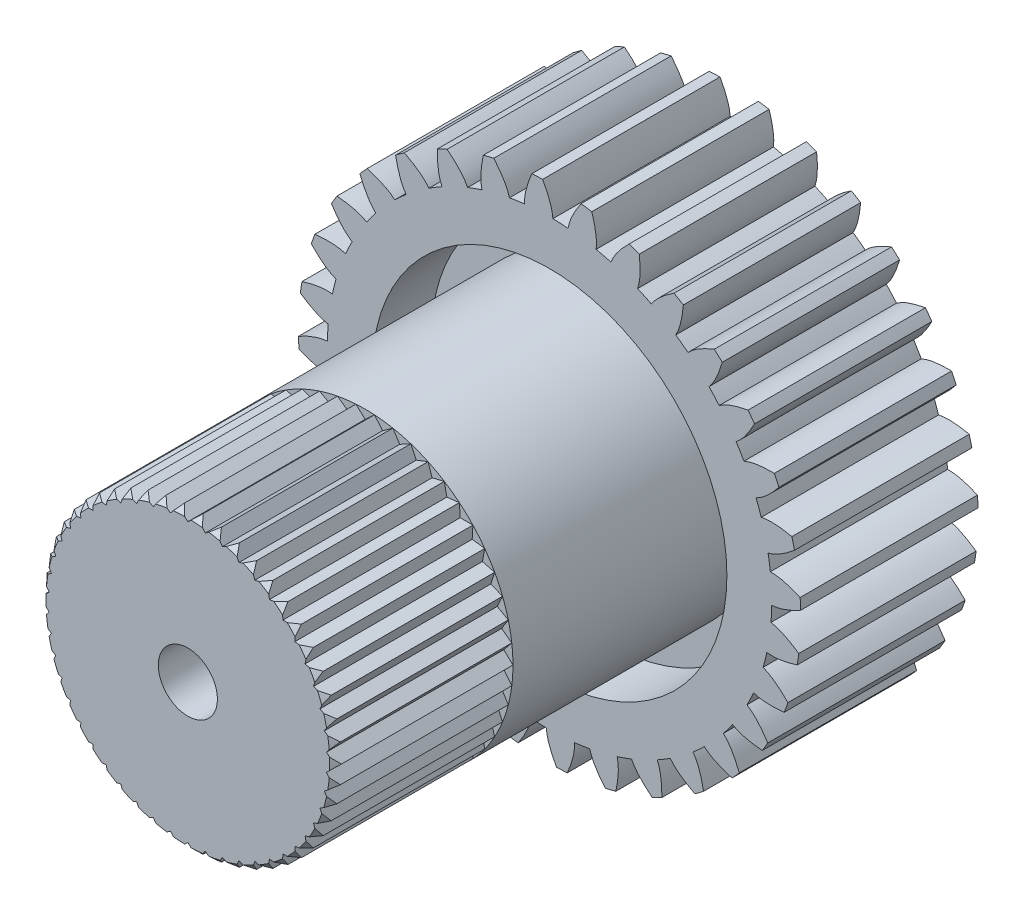
from build123d import *

# Parameters (mm, degrees)
BOSS_EXTRUDE7_DEPTH  = 3
CIRPATTERN1_COUNT    = 32
DIAMETRO_BASE_R      = 3.758770483
BOSS_EXTRUDE9_DEPTH  = 3
MOZZO_R              = 0.5
CUT_EXTRUDE1_DEPTH   = 3
SKETCH1_R            = 3
CUT_EXTRUDE2_DEPTH   = 1
SKETCH2_R            = 2.5
SKETCH2_R_2          = 0.5
BOSS_EXTRUDE10_DEPTH = 7.12
CHAMFER1_SIZE        = 0.1
CUT_EXTRUDE3_START   = -3
CUT_EXTRUDE3_DEPTH   = 3
CIRPATTERN2_COUNT    = 50


with BuildPart() as part:
    # profilo → Boss-Extrude7 (new body)
    with BuildSketch(Plane.XY):
        with BuildLine():
            Line((-0.208537616, 4.244880689), (-0.184434126, 3.754242879))
            ThreePointArc((-0.184434126, 3.754242879), (-0.064239901, 3.758221492), (0.056020084, 3.758353003))
            add(Edge.make_bspline(
                [(-0.116842984, 4.248393545), (-0.034075941, 4.096076065), (0.042378759, 3.933500457), (0.056020084, 3.758353003)],
                knots=[0.080011926, 0.080011926, 0.080011926, 0.080011926, 1, 1, 1, 1], degree=3))
            ThreePointArc((-0.116842984, 4.248393545), (-0.162699781, 4.246884597), (-0.208537616, 4.244880689))
        make_face()
    extrude(amount=BOSS_EXTRUDE7_DEPTH)

    # Mirror1: part across plane


with BuildPart() as part_1:
    add(part.part)
    add(part.part.mirror(Plane(origin=(0, 0, 0), x_dir=(0, 0, 1), z_dir=(0.9987954562051725, 0.0490676743274181, 0))))


with BuildPart() as cirpattern1_1:
    # CirPattern1: pattern copy
    add(part_1.part.rotate(Axis((0, 0, 3), (0, 0, 1)), 1 * 360 / CIRPATTERN1_COUNT))


with BuildPart() as cirpattern1_2:
    # CirPattern1: pattern copy
    add(part_1.part.rotate(Axis((0, 0, 3), (0, 0, 1)), 2 * 360 / CIRPATTERN1_COUNT))


with BuildPart() as cirpattern1_3:
    # CirPattern1: pattern copy
    add(part_1.part.rotate(Axis((0, 0, 3), (0, 0, 1)), 3 * 360 / CIRPATTERN1_COUNT))


with BuildPart() as cirpattern1_4:
    # CirPattern1: pattern copy
    add(part_1.part.rotate(Axis((0, 0, 3), (0, 0, 1)), 4 * 360 / CIRPATTERN1_COUNT))


with BuildPart() as cirpattern1_5:
    # CirPattern1: pattern copy
    add(part_1.part.rotate(Axis((0, 0, 3), (0, 0, 1)), 5 * 360 / CIRPATTERN1_COUNT))


with BuildPart() as cirpattern1_6:
    # CirPattern1: pattern copy
    add(part_1.part.rotate(Axis((0, 0, 3), (0, 0, 1)), 6 * 360 / CIRPATTERN1_COUNT))


with BuildPart() as cirpattern1_7:
    # CirPattern1: pattern copy
    add(part_1.part.rotate(Axis((0, 0, 3), (0, 0, 1)), 7 * 360 / CIRPATTERN1_COUNT))


with BuildPart() as cirpattern1_8:
    # CirPattern1: pattern copy
    add(part_1.part.rotate(Axis((0, 0, 3), (0, 0, 1)), 8 * 360 / CIRPATTERN1_COUNT))


with BuildPart() as cirpattern1_9:
    # CirPattern1: pattern copy
    add(part_1.part.rotate(Axis((0, 0, 3), (0, 0, 1)), 9 * 360 / CIRPATTERN1_COUNT))


with BuildPart() as cirpattern1_10:
    # CirPattern1: pattern copy
    add(part_1.part.rotate(Axis((0, 0, 3), (0, 0, 1)), 10 * 360 / CIRPATTERN1_COUNT))


with BuildPart() as cirpattern1_11:
    # CirPattern1: pattern copy
    add(part_1.part.rotate(Axis((0, 0, 3), (0, 0, 1)), 11 * 360 / CIRPATTERN1_COUNT))


with BuildPart() as cirpattern1_12:
    # CirPattern1: pattern copy
    add(part_1.part.rotate(Axis((0, 0, 3), (0, 0, 1)), 12 * 360 / CIRPATTERN1_COUNT))


with BuildPart() as cirpattern1_13:
    # CirPattern1: pattern copy
    add(part_1.part.rotate(Axis((0, 0, 3), (0, 0, 1)), 13 * 360 / CIRPATTERN1_COUNT))


with BuildPart() as cirpattern1_14:
    # CirPattern1: pattern copy
    add(part_1.part.rotate(Axis((0, 0, 3), (0, 0, 1)), 14 * 360 / CIRPATTERN1_COUNT))


with BuildPart() as cirpattern1_15:
    # CirPattern1: pattern copy
    add(part_1.part.rotate(Axis((0, 0, 3), (0, 0, 1)), 15 * 360 / CIRPATTERN1_COUNT))


with BuildPart() as cirpattern1_16:
    # CirPattern1: pattern copy
    add(part_1.part.rotate(Axis((0, 0, 3), (0, 0, 1)), 16 * 360 / CIRPATTERN1_COUNT))


with BuildPart() as cirpattern1_17:
    # CirPattern1: pattern copy
    add(part_1.part.rotate(Axis((0, 0, 3), (0, 0, 1)), 17 * 360 / CIRPATTERN1_COUNT))


with BuildPart() as cirpattern1_18:
    # CirPattern1: pattern copy
    add(part_1.part.rotate(Axis((0, 0, 3), (0, 0, 1)), 18 * 360 / CIRPATTERN1_COUNT))


with BuildPart() as cirpattern1_19:
    # CirPattern1: pattern copy
    add(part_1.part.rotate(Axis((0, 0, 3), (0, 0, 1)), 19 * 360 / CIRPATTERN1_COUNT))


with BuildPart() as cirpattern1_20:
    # CirPattern1: pattern copy
    add(part_1.part.rotate(Axis((0, 0, 3), (0, 0, 1)), 20 * 360 / CIRPATTERN1_COUNT))


with BuildPart() as cirpattern1_21:
    # CirPattern1: pattern copy
    add(part_1.part.rotate(Axis((0, 0, 3), (0, 0, 1)), 21 * 360 / CIRPATTERN1_COUNT))


with BuildPart() as cirpattern1_22:
    # CirPattern1: pattern copy
    add(part_1.part.rotate(Axis((0, 0, 3), (0, 0, 1)), 22 * 360 / CIRPATTERN1_COUNT))


with BuildPart() as cirpattern1_23:
    # CirPattern1: pattern copy
    add(part_1.part.rotate(Axis((0, 0, 3), (0, 0, 1)), 23 * 360 / CIRPATTERN1_COUNT))


with BuildPart() as cirpattern1_24:
    # CirPattern1: pattern copy
    add(part_1.part.rotate(Axis((0, 0, 3), (0, 0, 1)), 24 * 360 / CIRPATTERN1_COUNT))


with BuildPart() as cirpattern1_25:
    # CirPattern1: pattern copy
    add(part_1.part.rotate(Axis((0, 0, 3), (0, 0, 1)), 25 * 360 / CIRPATTERN1_COUNT))


with BuildPart() as cirpattern1_26:
    # CirPattern1: pattern copy
    add(part_1.part.rotate(Axis((0, 0, 3), (0, 0, 1)), 26 * 360 / CIRPATTERN1_COUNT))


with BuildPart() as cirpattern1_27:
    # CirPattern1: pattern copy
    add(part_1.part.rotate(Axis((0, 0, 3), (0, 0, 1)), 27 * 360 / CIRPATTERN1_COUNT))


with BuildPart() as cirpattern1_28:
    # CirPattern1: pattern copy
    add(part_1.part.rotate(Axis((0, 0, 3), (0, 0, 1)), 28 * 360 / CIRPATTERN1_COUNT))


with BuildPart() as cirpattern1_29:
    # CirPattern1: pattern copy
    add(part_1.part.rotate(Axis((0, 0, 3), (0, 0, 1)), 29 * 360 / CIRPATTERN1_COUNT))


with BuildPart() as cirpattern1_30:
    # CirPattern1: pattern copy
    add(part_1.part.rotate(Axis((0, 0, 3), (0, 0, 1)), 30 * 360 / CIRPATTERN1_COUNT))


with BuildPart() as cirpattern1_31:
    # CirPattern1: pattern copy
    add(part_1.part.rotate(Axis((0, 0, 3), (0, 0, 1)), 31 * 360 / CIRPATTERN1_COUNT))


with BuildPart() as part_2:
    add(part_1.part)

    add(cirpattern1_1.part)  # Boss-Extrude9 merges CirPattern1_1

    add(cirpattern1_2.part)  # Boss-Extrude9 merges CirPattern1_2

    add(cirpattern1_3.part)  # Boss-Extrude9 merges CirPattern1_3

    add(cirpattern1_4.part)  # Boss-Extrude9 merges CirPattern1_4

    add(cirpattern1_5.part)  # Boss-Extrude9 merges CirPattern1_5

    add(cirpattern1_6.part)  # Boss-Extrude9 merges CirPattern1_6

    add(cirpattern1_7.part)  # Boss-Extrude9 merges CirPattern1_7

    add(cirpattern1_8.part)  # Boss-Extrude9 merges CirPattern1_8

    add(cirpattern1_9.part)  # Boss-Extrude9 merges CirPattern1_9

    add(cirpattern1_10.part)  # Boss-Extrude9 merges CirPattern1_10

    add(cirpattern1_11.part)  # Boss-Extrude9 merges CirPattern1_11

    add(cirpattern1_12.part)  # Boss-Extrude9 merges CirPattern1_12

    add(cirpattern1_13.part)  # Boss-Extrude9 merges CirPattern1_13

    add(cirpattern1_14.part)  # Boss-Extrude9 merges CirPattern1_14

    add(cirpattern1_15.part)  # Boss-Extrude9 merges CirPattern1_15

    add(cirpattern1_16.part)  # Boss-Extrude9 merges CirPattern1_16

    add(cirpattern1_17.part)  # Boss-Extrude9 merges CirPattern1_17

    add(cirpattern1_18.part)  # Boss-Extrude9 merges CirPattern1_18

    add(cirpattern1_19.part)  # Boss-Extrude9 merges CirPattern1_19

    add(cirpattern1_20.part)  # Boss-Extrude9 merges CirPattern1_20

    add(cirpattern1_21.part)  # Boss-Extrude9 merges CirPattern1_21

    add(cirpattern1_22.part)  # Boss-Extrude9 merges CirPattern1_22

    add(cirpattern1_23.part)  # Boss-Extrude9 merges CirPattern1_23

    add(cirpattern1_24.part)  # Boss-Extrude9 merges CirPattern1_24

    add(cirpattern1_25.part)  # Boss-Extrude9 merges CirPattern1_25

    add(cirpattern1_26.part)  # Boss-Extrude9 merges CirPattern1_26

    add(cirpattern1_27.part)  # Boss-Extrude9 merges CirPattern1_27

    add(cirpattern1_28.part)  # Boss-Extrude9 merges CirPattern1_28

    add(cirpattern1_29.part)  # Boss-Extrude9 merges CirPattern1_29

    add(cirpattern1_30.part)  # Boss-Extrude9 merges CirPattern1_30

    add(cirpattern1_31.part)  # Boss-Extrude9 merges CirPattern1_31
    # diametro base → Boss-Extrude9 (add)
    with BuildSketch(Plane.XY):
        Circle(DIAMETRO_BASE_R)
    extrude(amount=BOSS_EXTRUDE9_DEPTH)

    # mozzo → Cut-Extrude1 (cut)
    with BuildSketch(Plane.XY):
        Circle(MOZZO_R)
    extrude(amount=CUT_EXTRUDE1_DEPTH, mode=Mode.SUBTRACT)

    # Sketch1 → Cut-Extrude2 (cut)
    with BuildSketch(Plane.XY.offset(3)):
        Circle(SKETCH1_R)
    extrude(amount=-CUT_EXTRUDE2_DEPTH, mode=Mode.SUBTRACT)

    # Sketch2 → Boss-Extrude10 (add)
    with BuildSketch(Plane.XY.offset(2)):
        Circle(SKETCH2_R)
        Circle(SKETCH2_R_2, mode=Mode.SUBTRACT)
    extrude(amount=BOSS_EXTRUDE10_DEPTH)

    # Chamfer1
    chamfer1_edges = [part_2.edges().sort_by_distance(p)[0] for p in [
        (-2.5, 0, 9.12),
    ]]
    chamfer(chamfer1_edges, length=CHAMFER1_SIZE)

    # Sketch3 → Cut-Extrude3 (cut)
    with BuildSketch(Plane.XY.offset(9.12).offset(CUT_EXTRUDE3_START)):
        with BuildLine():
            Line((0, 2.35), (-0.156976299, 2.495066821))
            ThreePointArc((-0.156976299, 2.495066821), (0, 2.5), (0.156976299, 2.495066821))
            Line((0.156976299, 2.495066821), (0, 2.35))
        make_face()
    cut_extrude3 = extrude(amount=CUT_EXTRUDE3_DEPTH, mode=Mode.SUBTRACT)

    # CirPattern2: Cut-Extrude3 ×50 about axis
    cirpattern2_axis = Axis((0, 0, 0), (0, 0, 1))
    for i in range(1, CIRPATTERN2_COUNT):
        add(cut_extrude3.rotate(cirpattern2_axis, i * 360 / CIRPATTERN2_COUNT), mode=Mode.SUBTRACT)


solid = part_2.part
